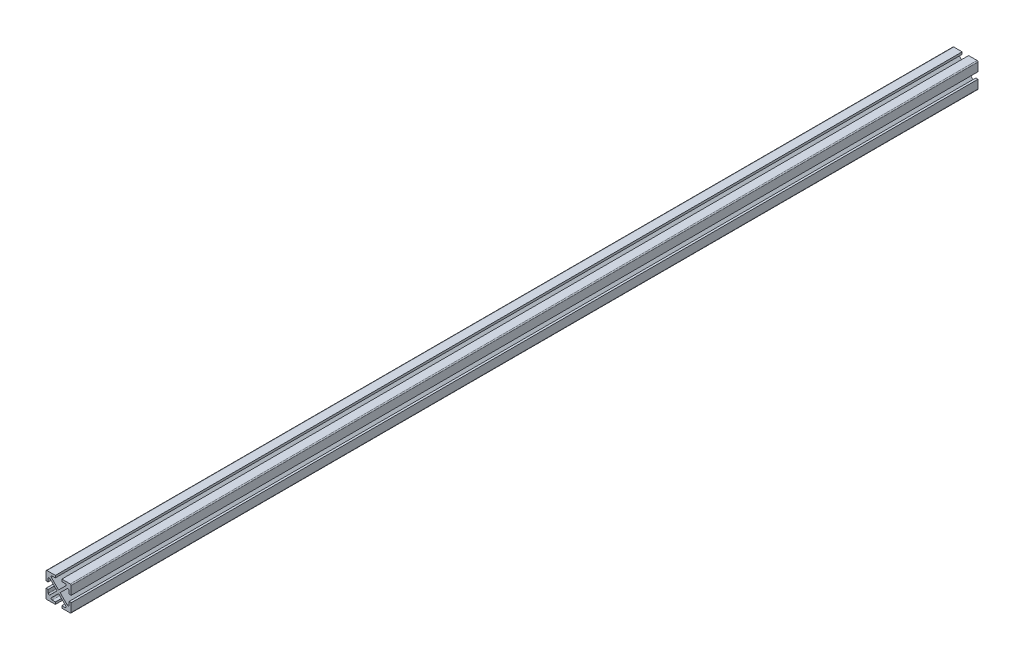
from build123d import *

# Parameters (mm, degrees)
BOSS_EXTRUDE1_DEPTH = 457.2
FILLET1_R           = 1


with BuildPart() as part:
    # Sketch1 → Boss-Extrude1 (new, symmetric)
    with BuildSketch(Plane.XY):
        Polygon((-3.2512, 10.4902), (-3.2512, 12.7), (-12.7, 12.7), (-12.7, 3.2512), (-10.4902, 3.2512), (-10.4902, 8.927635435), (-1.562564565, 0), (-10.4902, -8.927635435), (-10.4902, -3.2512), (-12.7, -3.2512), (-12.7, -12.7), (-3.2512, -12.7), (-3.2512, -10.4902), (-8.927635435, -10.4902), (0, -1.562564565), (8.927635435, -10.4902), (3.2512, -10.4902), (3.2512, -12.7), (12.7, -12.7), (12.7, -3.2512), (10.4902, -3.2512), (10.4902, -8.927635435), (1.562564565, 0), (10.4902, 8.927635435), (10.4902, 3.2512), (12.7, 3.2512), (12.7, 12.7), (3.2512, 12.7), (3.2512, 10.4902), (8.927635435, 10.4902), (0, 1.562564565), (-8.927635435, 10.4902), align=None)
    extrude(amount=BOSS_EXTRUDE1_DEPTH, both=True)

    # Fillet1
    fillet1_edges = [part.edges().sort_by_distance(p)[0] for p in [
        (10.4902, 8.927635435, 0),
        (8.927635435, 10.4902, 0),
        (10.4902, -8.927635435, 0),
        (8.927635435, -10.4902, 0),
        (-8.927635435, -10.4902, 0),
        (-10.4902, -8.927635435, 0),
        (-10.4902, 8.927635435, 0),
        (-8.927635435, 10.4902, 0),
        (-12.7, -12.7, 0),
        (12.7, -12.7, 0),
        (12.7, 12.7, 0),
        (-12.7, 12.7, 0),
    ]]
    fillet(fillet1_edges, radius=FILLET1_R)


solid = part.part
